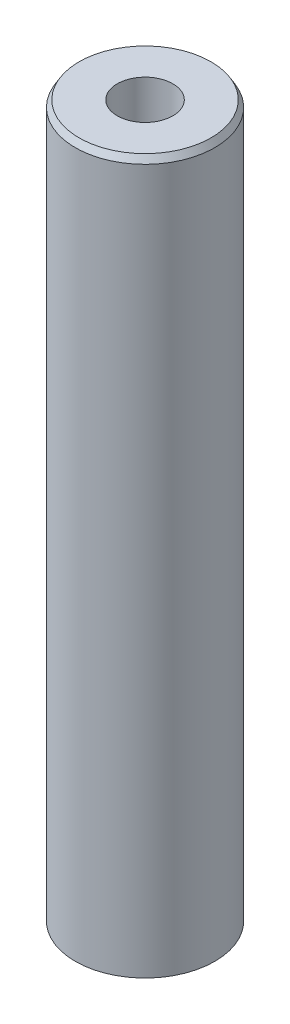
from build123d import *
from OCP.BRepFilletAPI import BRepFilletAPI_MakeChamfer

# Parameters (mm, degrees)
SKETCH1_R           = 35
BOSS_EXTRUDE1_DEPTH = 358.756242064
SKETCH2_R           = 13.943251447
CUT_EXTRUDE1_DEPTH  = 363.154720002
CHAMFER1_SIZE       = 3.300045368
CHAMFER1_SIZE2      = 1.905282082


with BuildPart() as part:
    # Sketch1 → Boss-Extrude1 (new body)
    with BuildSketch(Plane(origin=(0, 0, 0), x_dir=(1, 0, 0), z_dir=(0, 1, 0))):
        Circle(SKETCH1_R)
    extrude(amount=BOSS_EXTRUDE1_DEPTH)

    # Sketch2 → Cut-Extrude1 (cut, through all)
    with BuildSketch(Plane(origin=(0, 0, 0), x_dir=(1, 0, 0), z_dir=(0, 1, 0))):
        Circle(SKETCH2_R)
    extrude(amount=CUT_EXTRUDE1_DEPTH, mode=Mode.SUBTRACT)

    # Chamfer1: one chamfer whose edges measure the first distance from different faces: ONE call of the kernel's chamfer builder (chamfer() names one face for all edges)
    chamfer1_edges_1 = [part.edges().sort_by_distance(p)[0] for p in [
        (-35, 358.756242064, 0),
    ]]
    chamfer1_side_1 = [part.faces().sort_by_distance(p)[0] for p in [
        (-35, 179.378121032, 0),
    ]]
    chamfer1_edges_2 = [part.edges().sort_by_distance(p)[0] for p in [
        (-35, 0, 0),
    ]]
    chamfer1_side_2 = [part.faces().sort_by_distance(p)[0] for p in [
        (-34.010050506, 0, 0),
    ]]
    chamfer1 = BRepFilletAPI_MakeChamfer(part.part.solid().wrapped)
    for e in chamfer1_edges_1:
        chamfer1.Add(CHAMFER1_SIZE, CHAMFER1_SIZE2, e.wrapped, chamfer1_side_1[0].wrapped)  # the first distance lies on this face
    for e in chamfer1_edges_2:
        chamfer1.Add(CHAMFER1_SIZE, CHAMFER1_SIZE2, e.wrapped, chamfer1_side_2[0].wrapped)  # the first distance lies on this face
    add(Compound.cast(chamfer1.Shape()), mode=Mode.REPLACE)


solid = part.part
